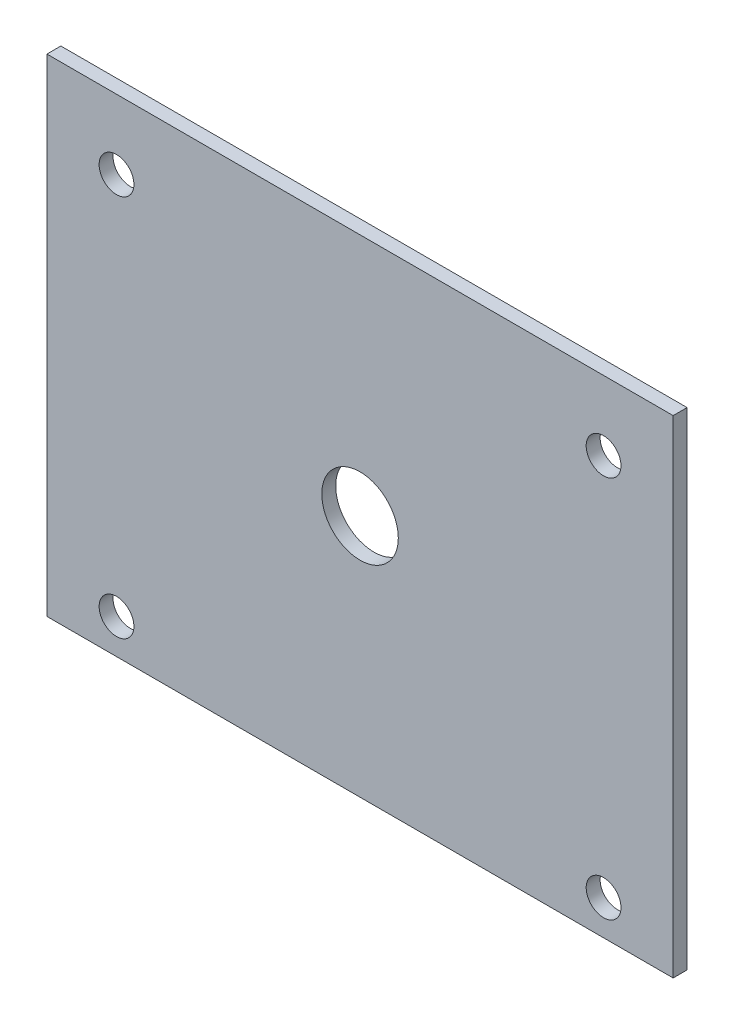
from build123d import *

# Parameters (mm, degrees)
SKETCH_1_W             = 90
SKETCH_1_H             = 70
SKETCH_1_R             = 5.5
SKETCH_1_R_2           = 2.5
SM_BASE_FLANGE_1_DEPTH = 2


# Sheet-metal steps are written as plain solids
with BuildPart() as part:
    # Sketch 1 → Базовая кромка1 (new body)
    with BuildSketch(Plane.XY):
        with Locations((45, 35)):
            Rectangle(SKETCH_1_W, SKETCH_1_H)
        with Locations((45, 35)):
            Circle(SKETCH_1_R, mode=Mode.SUBTRACT)
        with Locations((10, 60)):
            Circle(SKETCH_1_R_2, mode=Mode.SUBTRACT)
        with Locations((80, 60)):
            Circle(SKETCH_1_R_2, mode=Mode.SUBTRACT)
        with Locations((10, 5)):
            Circle(SKETCH_1_R_2, mode=Mode.SUBTRACT)
        with Locations((80, 5)):
            Circle(SKETCH_1_R_2, mode=Mode.SUBTRACT)
    extrude(amount=-SM_BASE_FLANGE_1_DEPTH)


solid = part.part
